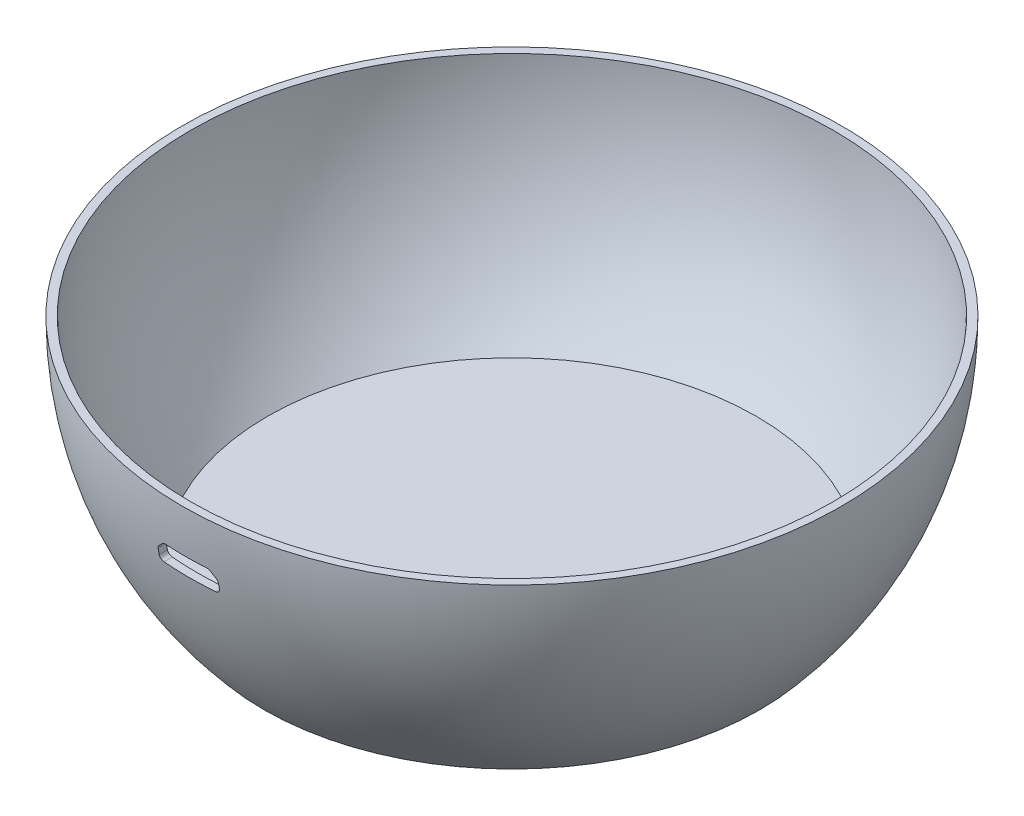
from build123d import *

# Parameters (mm, degrees)
SHELL2_T           = -1
CUT_EXTRUDE2_DEPTH = 96.571962416


with BuildPart() as part:
    # Sketch1 → Revolve1 (revolve)
    with BuildSketch(Plane.XY):
        with BuildLine():
            Line((0, 0), (41, 0))
            Line((41, 0), (41, -27))
            Line((41, -27), (15.768453788, -27))
            Line((15.768453788, -27), (10.145502759, -27))
            ThreePointArc((10.145502759, -27), (2.620093884, -14.421609014), (0, 0))
        make_face()
    revolve(axis=Axis((41, 0, 0), (0, -1, 0)))

    # Shell2
    shell2_openings = [part.faces().sort_by_distance(p)[0] for p in [
        (41, 0, 0),
    ]]
    offset(amount=SHELL2_T, openings=shell2_openings, kind=Kind.INTERSECTION)

    # Sketch8 → Cut-Extrude2 (cut, through all)
    with BuildSketch(Plane.XY):
        with BuildLine():
            Line((37.25, -7.5), (37.25, -6.753553389))
            ThreePointArc((37.25, -6.753553389), (37.291866257, -6.543077502), (37.41109127, -6.364644661))
            Line((37.41109127, -6.364644661), (38.014644661, -5.76109127))
            ThreePointArc((38.014644661, -5.76109127), (38.193077503, -5.641866257), (38.403553391, -5.6))
            Line((38.403553391, -5.6), (43.596446609, -5.6))
            ThreePointArc((43.596446609, -5.6), (43.806922497, -5.641866257), (43.985355339, -5.76109127))
            Line((43.985355339, -5.76109127), (44.58890873, -6.364644661))
            ThreePointArc((44.58890873, -6.364644661), (44.708133743, -6.543077502), (44.75, -6.753553389))
            Line((44.75, -6.753553389), (44.75, -7.5))
            ThreePointArc((44.75, -7.5), (44.58890873, -7.88890873), (44.2, -8.05))
            Line((44.2, -8.05), (37.8, -8.05))
            ThreePointArc((37.8, -8.05), (37.41109127, -7.88890873), (37.25, -7.5))
        make_face()
    extrude(amount=CUT_EXTRUDE2_DEPTH, mode=Mode.SUBTRACT)


solid = part.part
